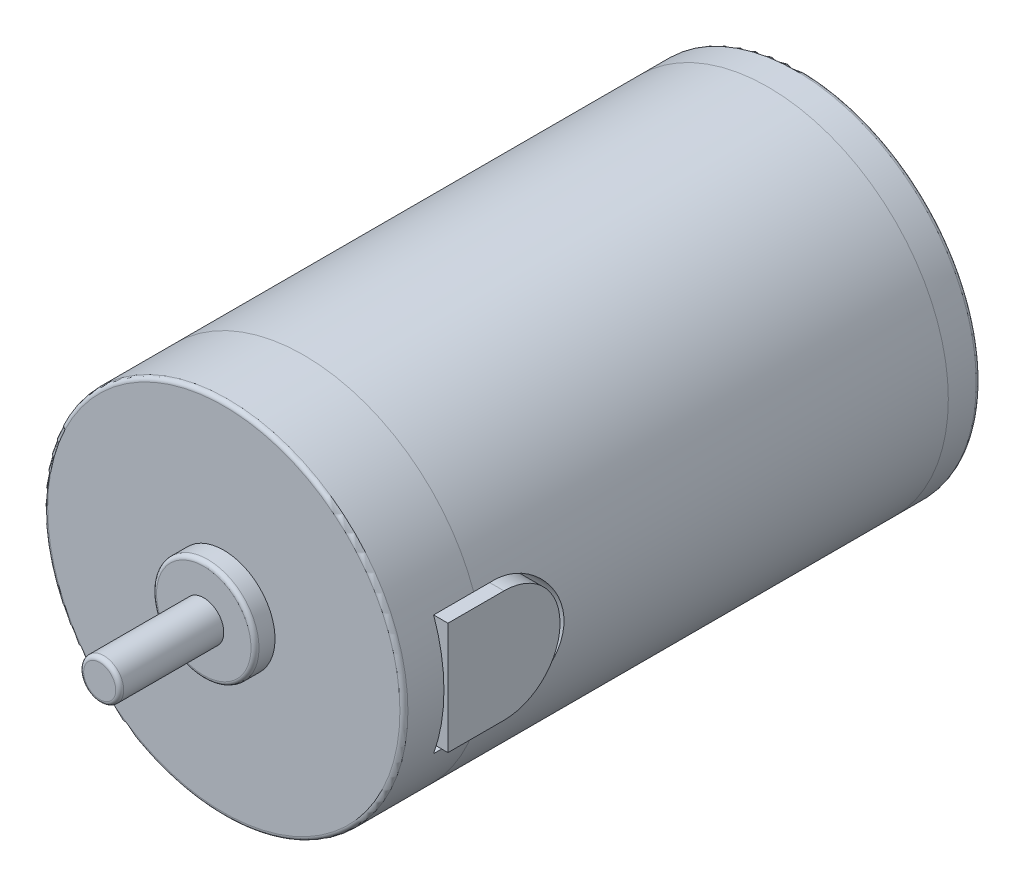
from build123d import *

# Parameters (mm, degrees)
FILLET1_R           = 0.5
CUT_EXTRUDE1_DEPTH  = 5
BOSS_EXTRUDE1_DEPTH = 5


with BuildPart() as part:
    # Sketch1 → Revolve1 (revolve)
    with BuildSketch(Plane(origin=(0, 0, 0), x_dir=(0, 0, -1), z_dir=(1, 0, 0))):
        Polygon((0, 0), (0, 22.5), (-72, 22.5), (-72, 6.4), (-74.5, 6.4), (-74.5, 2.5), (-87.5, 2.5), (-87.5, 0), align=None)
    revolve(axis=Axis((0, 0, 0), (0, 0, 1)))

    # Fillet1
    fillet1_edges = [part.edges().sort_by_distance(p)[0] for p in [
        (0, -6.4, 74.5),
        (0, -22.5, 0),
        (0, -22.5, 72),
        (0, -2.5, 87.5),
    ]]
    fillet(fillet1_edges, radius=FILLET1_R)

    # Sketch3 → Cut-Extrude1 (cut)
    with BuildSketch(Plane(origin=(22.5, 0, 0), x_dir=(0, 0, -1), z_dir=(1, 0, 0))):
        with BuildLine():
            Line((-67, -7.5), (-67, 7.5))
            Line((-67, 7.5), (-59.5, 7.5))
            ThreePointArc((-59.5, 7.5), (-52, 0), (-59.5, -7.5))
            Line((-59.5, -7.5), (-67, -7.5))
        make_face()
    cut_extrude1 = extrude(amount=-CUT_EXTRUDE1_DEPTH, mode=Mode.SUBTRACT)

    # Sketch4 → Boss-Extrude1 (add)
    with BuildSketch(Plane(origin=(17.5, 0, 0), x_dir=(0, 0, -1), z_dir=(1, 0, 0))):
        with BuildLine():
            Line((-66.5, -7), (-59.5, -7))
            ThreePointArc((-59.5, -7), (-52.5, 0), (-59.5, 7))
            Line((-59.5, 7), (-66.5, 7))
            Line((-66.5, 7), (-66.5, -7))
        make_face()
    boss_extrude1 = extrude(amount=BOSS_EXTRUDE1_DEPTH)

    # Mirror1: Cut-Extrude1, Boss-Extrude1 across plane
    add(cut_extrude1.mirror(Plane(origin=(0, 0, 0), x_dir=(0, 0, 1), z_dir=(1, 0, 0))), mode=Mode.SUBTRACT)
    add(boss_extrude1.mirror(Plane(origin=(0, 0, 0), x_dir=(0, 0, 1), z_dir=(1, 0, 0))))


solid = part.part
